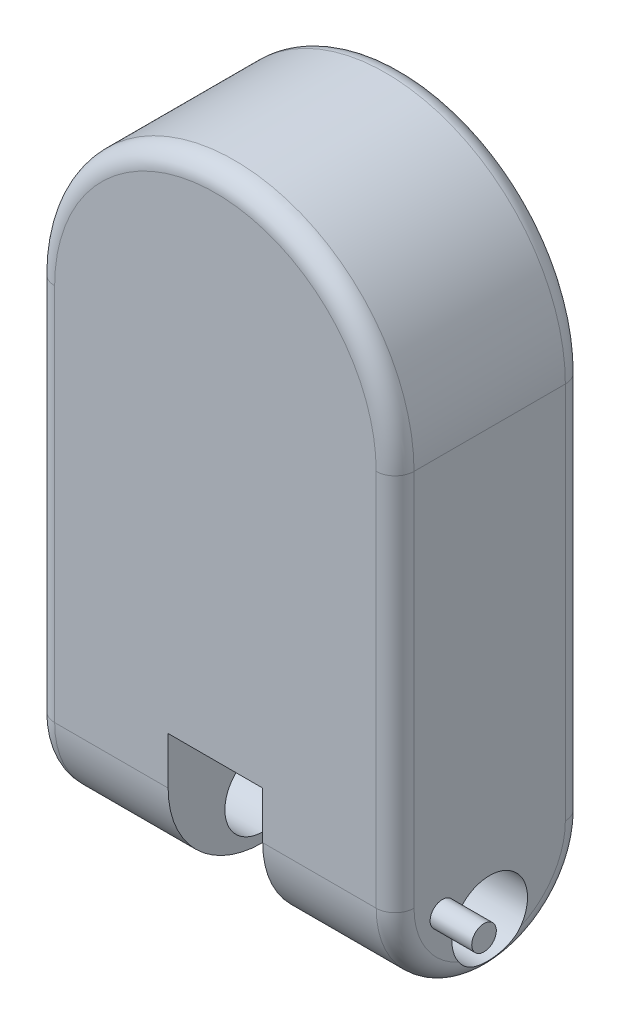
from build123d import *

# Parameters (mm, degrees)
BOSS_EXTRUDE1_DEPTH    = 100
SKETCH2_W              = 50
SKETCH2_H              = 50
CUT_EXTRUDE1_DEPTH     = 187.14510469
CUT_EXTRUDE2_DEPTH     = 25
SKETCH7_R              = 20
CUT_EXTRUDE3_DEPTH     = 249.445164976
FILLET2_R              = 50
CUT_EXTRUDE6_START     = -125
CUT_EXTRUDE6_OUTLINE_W = 50
CUT_EXTRUDE6_OUTLINE_H = 6.698729811
CUT_EXTRUDE6_DEPTH     = 50
CUT_EXTRUDE7_DEPTH     = 25
BOSS_EXTRUDE2_DEPTH    = 100
FILLET4_R              = 10
SKETCH11_W             = 50
SKETCH11_H             = 25
CUT_EXTRUDE11_DEPTH    = 99
SKETCH16_W             = 50
SKETCH16_H             = 30
BOSS_EXTRUDE3_DEPTH    = 0.1
FILLET5_R              = 10
SKETCH17_R             = 6.5
BOSS_EXTRUDE4_DEPTH    = 22


with BuildPart() as part:
    # Sketch1 → Boss-Extrude1 (new body)
    with BuildSketch(Plane.XY):
        Polygon((-95, 125), (20.2, 125), (69.8, 125), (95, 125), (95, -125), (-95, -125), align=None)
    extrude(amount=-BOSS_EXTRUDE1_DEPTH)

    # Sketch2 → Cut-Extrude1 (cut, through all)
    with BuildSketch(Plane.XY):
        with Locations((0, -125)):
            Rectangle(SKETCH2_W, SKETCH2_H)
    extrude(amount=-CUT_EXTRUDE1_DEPTH, mode=Mode.SUBTRACT)

    # Sketch6 → Cut-Extrude2 (cut, symmetric)
    with BuildSketch(Plane(origin=(0, 0, 0), x_dir=(0, 0, -1), z_dir=(1, 0, 0))):
        with BuildLine():
            Line((100, -100), (0, -100))
            ThreePointArc((0, -100), (50, -50), (100, -100))
        make_face()
    extrude(amount=CUT_EXTRUDE2_DEPTH, both=True, mode=Mode.SUBTRACT)

    # Sketch7 → Cut-Extrude3 (cut, through all)
    with BuildSketch(Plane.ZY.offset(95)):
        with Locations(Location((-50, -100, 0), (0, 0, 270))):
            Circle(SKETCH7_R)
    extrude(amount=-CUT_EXTRUDE3_DEPTH, mode=Mode.SUBTRACT)

    # Fillet2
    fillet2_edges = [part.edges().sort_by_distance(p)[0] for p in [
        (-60, -125, -100),
        (-60, -125, 0),
    ]]
    fillet(fillet2_edges, radius=FILLET2_R - 0.0001)  # a hair under: the kernel refuses the full size

    # Cut-Extrude6: read off the stored shape, not the designer's step
    # Cut-Extrude6 outline → Cut-Extrude6 (cut)
    with BuildSketch(Plane(origin=(0, 0, 0), x_dir=(1, 0, 0), z_dir=(0, 1, 0)).offset(CUT_EXTRUDE6_START)):
        with Locations((0, 96.650635095)):
            Rectangle(CUT_EXTRUDE6_OUTLINE_W, CUT_EXTRUDE6_OUTLINE_H)
        with Locations((0, 3.349364906)):
            Rectangle(CUT_EXTRUDE6_OUTLINE_W, CUT_EXTRUDE6_OUTLINE_H)
    extrude(amount=CUT_EXTRUDE6_DEPTH, mode=Mode.SUBTRACT)

    # Sketch10 → Cut-Extrude7 (cut, symmetric)
    with BuildSketch(Plane(origin=(0, 0, 0), x_dir=(0, 0, -1), z_dir=(1, 0, 0))):
        with BuildLine():
            Line((0, -75), (100, -75))
            ThreePointArc((100, -75), (50, -61.602540378), (0, -75))
        make_face()
    extrude(amount=CUT_EXTRUDE7_DEPTH, both=True, mode=Mode.SUBTRACT)

    # Sketch15 → Boss-Extrude2 (add)
    with BuildSketch(Plane.XY):
        with BuildLine():
            Line((-95, 125), (95, 125))
            ThreePointArc((95, 125), (0, 220), (-95, 125))
        make_face()
    extrude(amount=-BOSS_EXTRUDE2_DEPTH)

    # Fillet4
    # the kernel refuses this fillet: 10 mm, written as the material it takes off along each edge
    with BuildSketch(Plane(origin=(0, 125, -100), x_dir=(1, 0, 0), z_dir=(0, -1, 0))) as fillet4_piece_1:
        with BuildLine():
            CenterArc((95 - FILLET4_R, FILLET4_R), FILLET4_R, 270, 90)
            Line((95, FILLET4_R), (95, 0))
            Line((95, 0), (95 - FILLET4_R, 0))
        make_face()
    revolve(axis=Axis((0, 125, -100), (0, 0, 1)), revolution_arc=180, mode=Mode.SUBTRACT)
    with BuildSketch(Plane(origin=(0, 125, 0), x_dir=(1, 0, 0), z_dir=(0, -1, 0))) as fillet4_piece_2:
        with BuildLine():
            CenterArc((95 - FILLET4_R, -FILLET4_R), FILLET4_R, 0, 90)
            Line((95, -FILLET4_R), (95, 0))
            Line((95, 0), (95 - FILLET4_R, 0))
        make_face()
    revolve(axis=Axis((0, 125, 0), (0, 0, 1)), revolution_arc=180, mode=Mode.SUBTRACT)
    with BuildSketch(Plane(origin=(-95, -75.0001, -100), x_dir=(0, 0, 1), z_dir=(0, 1, 0)), Plane(origin=(95, 125, 0), x_dir=(-1, 0, 0), z_dir=(0, -1, 0))) as fillet4_piece_3:
        with BuildLine():
            CenterArc((FILLET4_R, FILLET4_R), FILLET4_R, 180, 90)
            Line((0, FILLET4_R), (0, 0))
            Line((0, 0), (FILLET4_R, 0))
        make_face()
    extrude(amount=200.0001, mode=Mode.SUBTRACT)
    with BuildSketch(Plane(origin=(95, 125, -100), x_dir=(-1, 0, 0), z_dir=(0, -1, 0)), Plane(origin=(-95, -75.0001, 0), x_dir=(0, 0, -1), z_dir=(0, 1, 0))) as fillet4_piece_4:
        with BuildLine():
            CenterArc((FILLET4_R, -FILLET4_R), FILLET4_R, 90, 90)
            Line((0, -FILLET4_R), (0, 0))
            Line((0, 0), (FILLET4_R, 0))
        make_face()
    extrude(amount=200.0001, mode=Mode.SUBTRACT)
    with BuildSketch(Plane(origin=(95, -75.0001, -49.9999), x_dir=(0, 0, 1), z_dir=(0, 1, 0))) as fillet4_piece_5:
        with BuildLine():
            CenterArc((49.9999 - FILLET4_R, -FILLET4_R), FILLET4_R, 0, 90)
            Line((49.9999 - FILLET4_R, 0), (49.9999, 0))
            Line((49.9999, 0), (49.9999, -FILLET4_R))
        make_face()
    revolve(axis=Axis((95, -75.0001, -49.9999), (1, 0, 0)), revolution_arc=90, mode=Mode.SUBTRACT)
    with BuildSketch(Plane(origin=(95, -75.0001, -50.0001), x_dir=(0, 0, -1), z_dir=(0, 1, 0))) as fillet4_piece_6:
        with BuildLine():
            CenterArc((49.9999 - FILLET4_R, FILLET4_R), FILLET4_R, 270, 90)
            Line((49.9999, FILLET4_R), (49.9999, 0))
            Line((49.9999, 0), (49.9999 - FILLET4_R, 0))
        make_face()
    revolve(axis=Axis((95, -75.0001, -50.0001), (-1, 0, 0)), revolution_arc=90, mode=Mode.SUBTRACT)
    with BuildSketch(Plane(origin=(-95, -75.0001, -49.9999), x_dir=(0, 0, 1), z_dir=(0, 1, 0))) as fillet4_piece_7:
        with BuildLine():
            CenterArc((49.9999 - FILLET4_R, FILLET4_R), FILLET4_R, 270, 90)
            Line((49.9999, FILLET4_R), (49.9999, 0))
            Line((49.9999, 0), (49.9999 - FILLET4_R, 0))
        make_face()
    revolve(axis=Axis((-95, -75.0001, -49.9999), (1, 0, 0)), revolution_arc=90, mode=Mode.SUBTRACT)
    with BuildSketch(Plane(origin=(-95, -75.0001, -50.0001), x_dir=(0, 0, -1), z_dir=(0, 1, 0))) as fillet4_piece_8:
        with BuildLine():
            CenterArc((49.9999 - FILLET4_R, -FILLET4_R), FILLET4_R, 0, 90)
            Line((49.9999, -FILLET4_R), (49.9999, 0))
            Line((49.9999, 0), (49.9999 - FILLET4_R, 0))
        make_face()
    revolve(axis=Axis((-95, -75.0001, -50.0001), (-1, 0, 0)), revolution_arc=90, mode=Mode.SUBTRACT)
    with BuildSketch(Plane(origin=(-95, -125, -49.9999), x_dir=(0, 1, 0), z_dir=(0, 0, -1))) as fillet4_piece_9:
        with BuildLine():
            CenterArc((FILLET4_R, FILLET4_R), FILLET4_R, 180, 90)
            Line((0, FILLET4_R), (0, 0))
            Line((0, 0), (FILLET4_R, 0))
        make_face()
    extrude(amount=0.0002, mode=Mode.SUBTRACT)
    with BuildSketch(Plane(origin=(95, -125, -49.9999), x_dir=(0, 1, 0), z_dir=(0, 0, -1))) as fillet4_piece_10:
        with BuildLine():
            CenterArc((FILLET4_R, -FILLET4_R), FILLET4_R, 90, 90)
            Line((0, -FILLET4_R), (0, 0))
            Line((0, 0), (FILLET4_R, 0))
        make_face()
    extrude(amount=0.0002, mode=Mode.SUBTRACT)

    # Sketch11 → Cut-Extrude11 (cut)
    with BuildSketch(Plane.XY):
        with Locations((0, -62.5)):
            Rectangle(SKETCH11_W, SKETCH11_H)
    extrude(amount=-CUT_EXTRUDE11_DEPTH, mode=Mode.SUBTRACT)

    # Sketch17 → Boss-Extrude4 (add)
    with BuildSketch(Plane(origin=(95, 0, 0), x_dir=(0, 0, -1), z_dir=(1, 0, 0))):
        with Locations(Location((25, -85, 0), (0, 0, 90))):
            Circle(SKETCH17_R)
    extrude(amount=BOSS_EXTRUDE4_DEPTH)


with BuildPart() as body_2:
    # Sketch16 → Boss-Extrude3 (new body)
    with BuildSketch(Plane(origin=(0, 0, -100), x_dir=(-1, 0, 0), z_dir=(0, 0, -1))):
        with Locations((0, -90)):
            Rectangle(SKETCH16_W, SKETCH16_H)
    extrude(amount=BOSS_EXTRUDE3_DEPTH)

    # Fillet5
    # the kernel refuses this fillet: 10 mm, written as the material it takes off along each edge
    with BuildSketch(Plane(origin=(25, -71.473316005, -100.1), x_dir=(0, 0, 1), z_dir=(0, -1, 0)), Plane(origin=(-25, -108.526683995, -100.1), x_dir=(0, 0, 1), z_dir=(0, 1, 0))) as fillet5_piece_1:
        with BuildLine():
            CenterArc((10, 1.410673598), FILLET5_R, 180, 8.109614456)
            Line((0, 1.410673598), (0, 0))
            Line((0, 0), (0.1, 0))
        make_face()
    extrude(amount=37.05336799, mode=Mode.SUBTRACT)
    with BuildSketch(Plane(origin=(28.526683995, -105, -100.1), x_dir=(0, 0, 1), z_dir=(-1, 0, 0))) as fillet5_piece_2:
        with BuildLine():
            CenterArc((10, 1.410673598), FILLET5_R, 180, 8.109614456)
            Line((0, 1.410673598), (0, 0))
            Line((0, 0), (0.1, 0))
        make_face()
    extrude(amount=57.05336799, mode=Mode.SUBTRACT)


solid = Compound([part.part, body_2.part])
